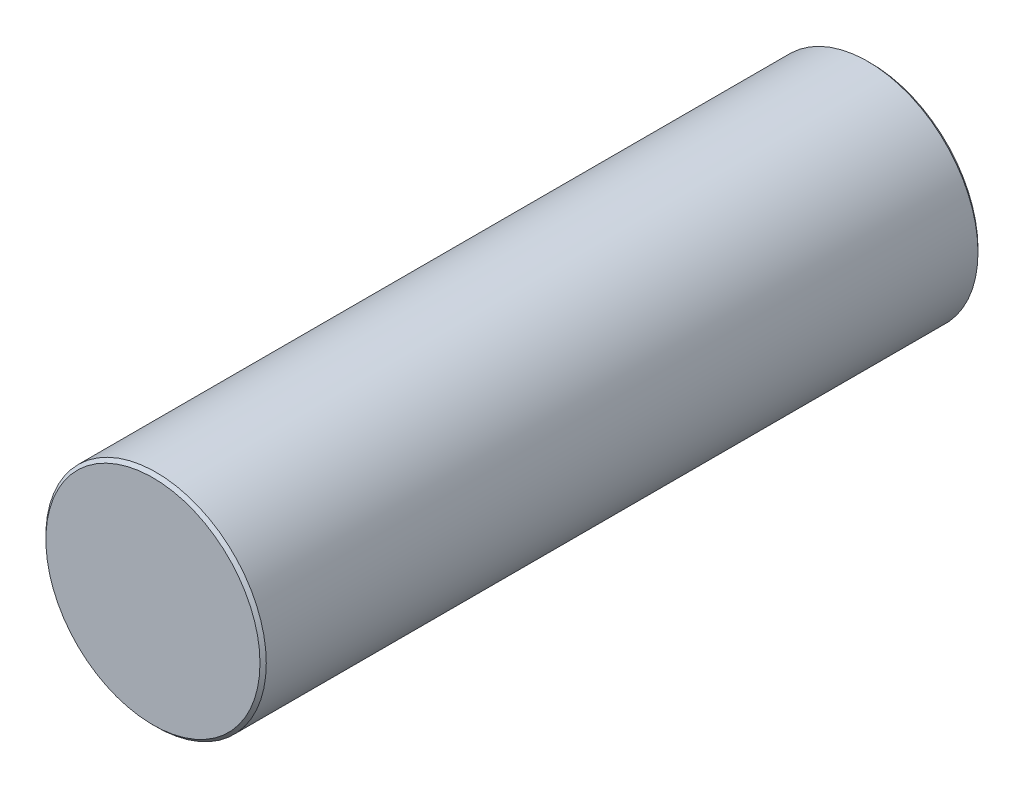
from build123d import *

# Parameters (mm, degrees)
SKETCH2_R           = 1.75
BOSS_EXTRUDE1_DEPTH = 11.4
CHAMFER2_SIZE       = 0.05


with BuildPart() as part:
    # Sketch2 → Boss-Extrude1 (new body)
    with BuildSketch(Plane.XY):
        Circle(SKETCH2_R)
    extrude(amount=BOSS_EXTRUDE1_DEPTH)

    # Chamfer2
    chamfer2_edges = [part.edges().sort_by_distance(p)[0] for p in [
        (-1.75, 0, 11.4),
        (-1.75, 0, 0),
    ]]
    chamfer(chamfer2_edges, length=CHAMFER2_SIZE)


solid = part.part
